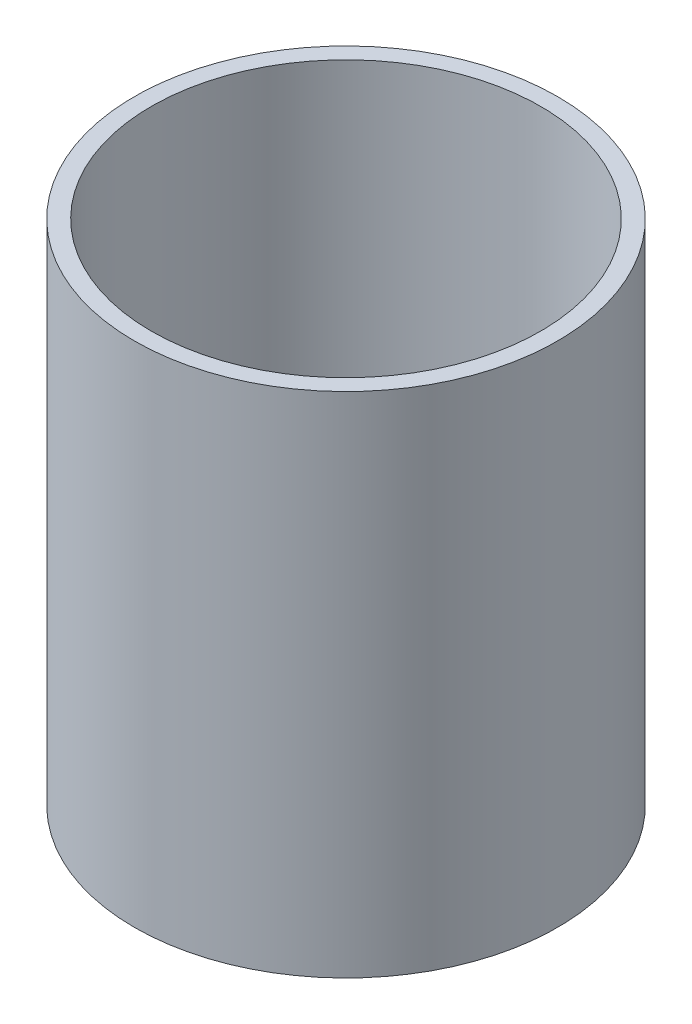
from build123d import *

# Parameters (mm, degrees)
SKETCH1_R           = 1250
SKETCH1_R_2         = 1150
BOSS_EXTRUDE1_DEPTH = 3000


with BuildPart() as part:
    # Sketch1 → Boss-Extrude1 (new body)
    with BuildSketch(Plane(origin=(0, 0, 0), x_dir=(1, 0, 0), z_dir=(0, 1, 0))):
        Circle(SKETCH1_R)
        Circle(SKETCH1_R_2, mode=Mode.SUBTRACT)
    extrude(amount=BOSS_EXTRUDE1_DEPTH)


solid = part.part
